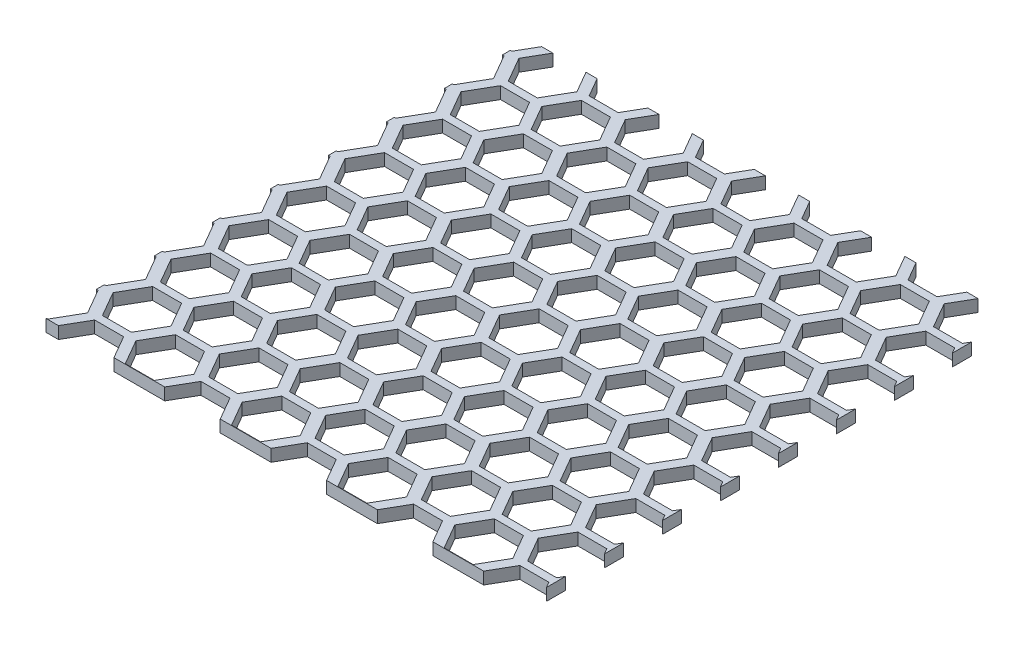
from build123d import *

# Parameters (mm, degrees)
BOSS_EXTRUDE1_DEPTH = 25


with BuildPart() as part:
    # Sketch3 → Boss-Extrude1 (new body)
    with BuildSketch(Plane(origin=(0, 0, 0), x_dir=(1, 0, 0), z_dir=(0, 1, 0))):
        Polygon((147.588442541, 499.910197686), (124.494431774, 499.910197686), (101.933591751, 460.833676505), (98.761267505, 460.833676505), (98.761267505, 444.756724959), (101.933591751, 444.756724959), (131.933591751, 392.795200732), (101.933591751, 340.833676505), (98.761267505, 340.833676505), (98.761267505, 324.756724959), (101.933591751, 324.756724959), (131.933591751, 272.795200732), (101.933591751, 220.833676505), (98.761267505, 220.833676505), (98.761267505, 204.756724959), (101.933591751, 204.756724959), (131.933591751, 152.795200732), (101.933591751, 100.833676505), (98.761267505, 100.833676505), (98.761267505, 84.756724959), (101.933591751, 84.756724959), (131.933591751, 32.795200732), (101.933591751, -19.166323495), (98.761267505, -19.166323495), (98.761267505, -35.243275041), (101.933591751, -35.243275041), (131.933591751, -87.204799268), (101.933591751, -139.166323495), (98.761267505, -139.166323495), (98.761267505, -155.243275041), (101.933591751, -155.243275041), (131.933591751, -207.204799268), (101.933591751, -259.166323495), (98.761267505, -259.166323495), (98.761267505, -275.243275041), (101.933591751, -275.243275041), (131.933591751, -327.204799268), (101.933591751, -379.166323495), (98.761267505, -379.166323495), (98.761267505, -395.243275041), (101.933591751, -395.243275041), (131.933591751, -447.204799268), (101.933591751, -499.166323495), (98.761267505, -499.166323495), (98.761267505, -500.089802314), (124.494431774, -500.089802314), (151.933591751, -452.563783117), (211.933591751, -452.563783117), (239.372751728, -500.089802314), (344.494431774, -500.089802314), (371.933591751, -452.563783117), (431.933591751, -452.563783117), (459.372751728, -500.089802314), (564.494431774, -500.089802314), (591.933591751, -452.563783117), (651.933591751, -452.563783117), (679.372751728, -500.089802314), (784.494431774, -500.089802314), (811.933591751, -452.563783117), (871.933591751, -452.563783117), (899.372751728, -500.089802314), (1004.494431774, -500.089802314), (1031.933591751, -452.563783117), (1091.933591751, -452.563783117), (1098.761267505, -464.389664421), (1098.761267505, -424.660950267), (1091.933591751, -436.486831571), (1031.933591751, -436.486831571), (1001.933591751, -384.525307344), (1031.933591751, -332.563783117), (1091.933591751, -332.563783117), (1098.761267505, -344.389664421), (1098.761267505, -304.660950267), (1091.933591751, -316.486831571), (1031.933591751, -316.486831571), (1001.933591751, -264.525307344), (1031.933591751, -212.563783117), (1091.933591751, -212.563783117), (1098.761267505, -224.389664421), (1098.761267505, -184.660950267), (1091.933591751, -196.486831571), (1031.933591751, -196.486831571), (1001.933591751, -144.525307344), (1031.933591751, -92.563783117), (1091.933591751, -92.563783117), (1098.761267505, -104.389664421), (1098.761267505, -64.660950267), (1091.933591751, -76.486831571), (1031.933591751, -76.486831571), (1001.933591751, -24.525307344), (1031.933591751, 27.436216883), (1091.933591751, 27.436216883), (1098.761267505, 15.610335579), (1098.761267505, 55.339049733), (1091.933591751, 43.513168429), (1031.933591751, 43.513168429), (1001.933591751, 95.474692656), (1031.933591751, 147.436216883), (1091.933591751, 147.436216883), (1098.761267505, 135.610335579), (1098.761267505, 175.339049733), (1091.933591751, 163.513168429), (1031.933591751, 163.513168429), (1001.933591751, 215.474692656), (1031.933591751, 267.436216883), (1091.933591751, 267.436216883), (1098.761267505, 255.610335579), (1098.761267505, 295.339049733), (1091.933591751, 283.513168429), (1031.933591751, 283.513168429), (1001.933591751, 335.474692656), (1031.933591751, 387.436216883), (1091.933591751, 387.436216883), (1098.761267505, 375.610335579), (1098.761267505, 415.339049733), (1091.933591751, 403.513168429), (1031.933591751, 403.513168429), (1001.933591751, 455.474692656), (1027.588442541, 499.910197686), (1004.494431774, 499.910197686), (981.933591751, 460.833676505), (921.933591751, 460.833676505), (899.372751728, 499.910197686), (876.27874096, 499.910197686), (901.933591751, 455.474692656), (871.933591751, 403.513168429), (811.933591751, 403.513168429), (781.933591751, 455.474692656), (807.588442541, 499.910197686), (784.494431774, 499.910197686), (761.933591751, 460.833676505), (701.933591751, 460.833676505), (679.372751728, 499.910197686), (656.27874096, 499.910197686), (681.933591751, 455.474692656), (651.933591751, 403.513168429), (591.933591751, 403.513168429), (561.933591751, 455.474692656), (587.588442541, 499.910197686), (564.494431774, 499.910197686), (541.933591751, 460.833676505), (481.933591751, 460.833676505), (459.372751728, 499.910197686), (436.27874096, 499.910197686), (461.933591751, 455.474692656), (431.933591751, 403.513168429), (371.933591751, 403.513168429), (341.933591751, 455.474692656), (367.588442541, 499.910197686), (344.494431774, 499.910197686), (321.933591751, 460.833676505), (261.933591751, 460.833676505), (239.372751728, 499.910197686), (216.27874096, 499.910197686), (241.933591751, 455.474692656), (211.933591751, 403.513168429), (151.933591751, 403.513168429), (121.933591751, 455.474692656), align=None)
        Polygon((321.933591751, -395.243275041), (351.933591751, -447.204799268), (321.933591751, -499.166323495), (261.933591751, -499.166323495), (231.933591751, -447.204799268), (261.933591751, -395.243275041), align=None, mode=Mode.SUBTRACT)
        Polygon((211.933591751, -332.563783117), (241.933591751, -384.525307344), (211.933591751, -436.486831571), (151.933591751, -436.486831571), (121.933591751, -384.525307344), (151.933591751, -332.563783117), align=None, mode=Mode.SUBTRACT)
        Polygon((431.933591751, -332.563783117), (461.933591751, -384.525307344), (431.933591751, -436.486831571), (371.933591751, -436.486831571), (341.933591751, -384.525307344), (371.933591751, -332.563783117), align=None, mode=Mode.SUBTRACT)
        Polygon((541.933591751, -395.243275041), (571.933591751, -447.204799268), (541.933591751, -499.166323495), (481.933591751, -499.166323495), (451.933591751, -447.204799268), (481.933591751, -395.243275041), align=None, mode=Mode.SUBTRACT)
        Polygon((651.933591751, -332.563783117), (681.933591751, -384.525307344), (651.933591751, -436.486831571), (591.933591751, -436.486831571), (561.933591751, -384.525307344), (591.933591751, -332.563783117), align=None, mode=Mode.SUBTRACT)
        Polygon((321.933591751, -275.243275041), (351.933591751, -327.204799268), (321.933591751, -379.166323495), (261.933591751, -379.166323495), (231.933591751, -327.204799268), (261.933591751, -275.243275041), align=None, mode=Mode.SUBTRACT)
        Polygon((211.933591751, -212.563783117), (241.933591751, -264.525307344), (211.933591751, -316.486831571), (151.933591751, -316.486831571), (121.933591751, -264.525307344), (151.933591751, -212.563783117), align=None, mode=Mode.SUBTRACT)
        Polygon((211.933591751, -92.563783117), (241.933591751, -144.525307344), (211.933591751, -196.486831571), (151.933591751, -196.486831571), (121.933591751, -144.525307344), (151.933591751, -92.563783117), align=None, mode=Mode.SUBTRACT)
        Polygon((321.933591751, -155.243275041), (351.933591751, -207.204799268), (321.933591751, -259.166323495), (261.933591751, -259.166323495), (231.933591751, -207.204799268), (261.933591751, -155.243275041), align=None, mode=Mode.SUBTRACT)
        Polygon((321.933591751, -35.243275041), (351.933591751, -87.204799268), (321.933591751, -139.166323495), (261.933591751, -139.166323495), (231.933591751, -87.204799268), (261.933591751, -35.243275041), align=None, mode=Mode.SUBTRACT)
        Polygon((431.933591751, -212.563783117), (461.933591751, -264.525307344), (431.933591751, -316.486831571), (371.933591751, -316.486831571), (341.933591751, -264.525307344), (371.933591751, -212.563783117), align=None, mode=Mode.SUBTRACT)
        Polygon((541.933591751, -275.243275041), (571.933591751, -327.204799268), (541.933591751, -379.166323495), (481.933591751, -379.166323495), (451.933591751, -327.204799268), (481.933591751, -275.243275041), align=None, mode=Mode.SUBTRACT)
        Polygon((651.933591751, -212.563783117), (681.933591751, -264.525307344), (651.933591751, -316.486831571), (591.933591751, -316.486831571), (561.933591751, -264.525307344), (591.933591751, -212.563783117), align=None, mode=Mode.SUBTRACT)
        Polygon((431.933591751, -92.563783117), (461.933591751, -144.525307344), (431.933591751, -196.486831571), (371.933591751, -196.486831571), (341.933591751, -144.525307344), (371.933591751, -92.563783117), align=None, mode=Mode.SUBTRACT)
        Polygon((541.933591751, -155.243275041), (571.933591751, -207.204799268), (541.933591751, -259.166323495), (481.933591751, -259.166323495), (451.933591751, -207.204799268), (481.933591751, -155.243275041), align=None, mode=Mode.SUBTRACT)
        Polygon((651.933591751, -92.563783117), (681.933591751, -144.525307344), (651.933591751, -196.486831571), (591.933591751, -196.486831571), (561.933591751, -144.525307344), (591.933591751, -92.563783117), align=None, mode=Mode.SUBTRACT)
        Polygon((541.933591751, -35.243275041), (571.933591751, -87.204799268), (541.933591751, -139.166323495), (481.933591751, -139.166323495), (451.933591751, -87.204799268), (481.933591751, -35.243275041), align=None, mode=Mode.SUBTRACT)
        Polygon((761.933591751, -395.243275041), (791.933591751, -447.204799268), (761.933591751, -499.166323495), (701.933591751, -499.166323495), (671.933591751, -447.204799268), (701.933591751, -395.243275041), align=None, mode=Mode.SUBTRACT)
        Polygon((871.933591751, -332.563783117), (901.933591751, -384.525307344), (871.933591751, -436.486831571), (811.933591751, -436.486831571), (781.933591751, -384.525307344), (811.933591751, -332.563783117), align=None, mode=Mode.SUBTRACT)
        Polygon((981.933591751, -395.243275041), (1011.933591751, -447.204799268), (981.933591751, -499.166323495), (921.933591751, -499.166323495), (891.933591751, -447.204799268), (921.933591751, -395.243275041), align=None, mode=Mode.SUBTRACT)
        Polygon((761.933591751, -275.243275041), (791.933591751, -327.204799268), (761.933591751, -379.166323495), (701.933591751, -379.166323495), (671.933591751, -327.204799268), (701.933591751, -275.243275041), align=None, mode=Mode.SUBTRACT)
        Polygon((871.933591751, -212.563783117), (901.933591751, -264.525307344), (871.933591751, -316.486831571), (811.933591751, -316.486831571), (781.933591751, -264.525307344), (811.933591751, -212.563783117), align=None, mode=Mode.SUBTRACT)
        Polygon((981.933591751, -275.243275041), (1011.933591751, -327.204799268), (981.933591751, -379.166323495), (921.933591751, -379.166323495), (891.933591751, -327.204799268), (921.933591751, -275.243275041), align=None, mode=Mode.SUBTRACT)
        Polygon((761.933591751, -155.243275041), (791.933591751, -207.204799268), (761.933591751, -259.166323495), (701.933591751, -259.166323495), (671.933591751, -207.204799268), (701.933591751, -155.243275041), align=None, mode=Mode.SUBTRACT)
        Polygon((871.933591751, -92.563783117), (901.933591751, -144.525307344), (871.933591751, -196.486831571), (811.933591751, -196.486831571), (781.933591751, -144.525307344), (811.933591751, -92.563783117), align=None, mode=Mode.SUBTRACT)
        Polygon((761.933591751, -35.243275041), (791.933591751, -87.204799268), (761.933591751, -139.166323495), (701.933591751, -139.166323495), (671.933591751, -87.204799268), (701.933591751, -35.243275041), align=None, mode=Mode.SUBTRACT)
        Polygon((981.933591751, -155.243275041), (1011.933591751, -207.204799268), (981.933591751, -259.166323495), (921.933591751, -259.166323495), (891.933591751, -207.204799268), (921.933591751, -155.243275041), align=None, mode=Mode.SUBTRACT)
        Polygon((981.933591751, -35.243275041), (1011.933591751, -87.204799268), (981.933591751, -139.166323495), (921.933591751, -139.166323495), (891.933591751, -87.204799268), (921.933591751, -35.243275041), align=None, mode=Mode.SUBTRACT)
        Polygon((211.933591751, 27.436216883), (241.933591751, -24.525307344), (211.933591751, -76.486831571), (151.933591751, -76.486831571), (121.933591751, -24.525307344), (151.933591751, 27.436216883), align=None, mode=Mode.SUBTRACT)
        Polygon((211.933591751, 147.436216883), (241.933591751, 95.474692656), (211.933591751, 43.513168429), (151.933591751, 43.513168429), (121.933591751, 95.474692656), (151.933591751, 147.436216883), align=None, mode=Mode.SUBTRACT)
        Polygon((321.933591751, 84.756724959), (351.933591751, 32.795200732), (321.933591751, -19.166323495), (261.933591751, -19.166323495), (231.933591751, 32.795200732), (261.933591751, 84.756724959), align=None, mode=Mode.SUBTRACT)
        Polygon((321.933591751, 204.756724959), (351.933591751, 152.795200732), (321.933591751, 100.833676505), (261.933591751, 100.833676505), (231.933591751, 152.795200732), (261.933591751, 204.756724959), align=None, mode=Mode.SUBTRACT)
        Polygon((211.933591751, 267.436216883), (241.933591751, 215.474692656), (211.933591751, 163.513168429), (151.933591751, 163.513168429), (121.933591751, 215.474692656), (151.933591751, 267.436216883), align=None, mode=Mode.SUBTRACT)
        Polygon((431.933591751, 27.436216883), (461.933591751, -24.525307344), (431.933591751, -76.486831571), (371.933591751, -76.486831571), (341.933591751, -24.525307344), (371.933591751, 27.436216883), align=None, mode=Mode.SUBTRACT)
        Polygon((431.933591751, 147.436216883), (461.933591751, 95.474692656), (431.933591751, 43.513168429), (371.933591751, 43.513168429), (341.933591751, 95.474692656), (371.933591751, 147.436216883), align=None, mode=Mode.SUBTRACT)
        Polygon((651.933591751, 27.436216883), (681.933591751, -24.525307344), (651.933591751, -76.486831571), (591.933591751, -76.486831571), (561.933591751, -24.525307344), (591.933591751, 27.436216883), align=None, mode=Mode.SUBTRACT)
        Polygon((541.933591751, 84.756724959), (571.933591751, 32.795200732), (541.933591751, -19.166323495), (481.933591751, -19.166323495), (451.933591751, 32.795200732), (481.933591751, 84.756724959), align=None, mode=Mode.SUBTRACT)
        Polygon((651.933591751, 147.436216883), (681.933591751, 95.474692656), (651.933591751, 43.513168429), (591.933591751, 43.513168429), (561.933591751, 95.474692656), (591.933591751, 147.436216883), align=None, mode=Mode.SUBTRACT)
        Polygon((431.933591751, 267.436216883), (461.933591751, 215.474692656), (431.933591751, 163.513168429), (371.933591751, 163.513168429), (341.933591751, 215.474692656), (371.933591751, 267.436216883), align=None, mode=Mode.SUBTRACT)
        Polygon((541.933591751, 204.756724959), (571.933591751, 152.795200732), (541.933591751, 100.833676505), (481.933591751, 100.833676505), (451.933591751, 152.795200732), (481.933591751, 204.756724959), align=None, mode=Mode.SUBTRACT)
        Polygon((651.933591751, 267.436216883), (681.933591751, 215.474692656), (651.933591751, 163.513168429), (591.933591751, 163.513168429), (561.933591751, 215.474692656), (591.933591751, 267.436216883), align=None, mode=Mode.SUBTRACT)
        Polygon((321.933591751, 324.756724959), (351.933591751, 272.795200732), (321.933591751, 220.833676505), (261.933591751, 220.833676505), (231.933591751, 272.795200732), (261.933591751, 324.756724959), align=None, mode=Mode.SUBTRACT)
        Polygon((211.933591751, 387.436216883), (241.933591751, 335.474692656), (211.933591751, 283.513168429), (151.933591751, 283.513168429), (121.933591751, 335.474692656), (151.933591751, 387.436216883), align=None, mode=Mode.SUBTRACT)
        Polygon((321.933591751, 444.756724959), (351.933591751, 392.795200732), (321.933591751, 340.833676505), (261.933591751, 340.833676505), (231.933591751, 392.795200732), (261.933591751, 444.756724959), align=None, mode=Mode.SUBTRACT)
        Polygon((431.933591751, 387.436216883), (461.933591751, 335.474692656), (431.933591751, 283.513168429), (371.933591751, 283.513168429), (341.933591751, 335.474692656), (371.933591751, 387.436216883), align=None, mode=Mode.SUBTRACT)
        Polygon((541.933591751, 324.756724959), (571.933591751, 272.795200732), (541.933591751, 220.833676505), (481.933591751, 220.833676505), (451.933591751, 272.795200732), (481.933591751, 324.756724959), align=None, mode=Mode.SUBTRACT)
        Polygon((541.933591751, 444.756724959), (571.933591751, 392.795200732), (541.933591751, 340.833676505), (481.933591751, 340.833676505), (451.933591751, 392.795200732), (481.933591751, 444.756724959), align=None, mode=Mode.SUBTRACT)
        Polygon((651.933591751, 387.436216883), (681.933591751, 335.474692656), (651.933591751, 283.513168429), (591.933591751, 283.513168429), (561.933591751, 335.474692656), (591.933591751, 387.436216883), align=None, mode=Mode.SUBTRACT)
        Polygon((871.933591751, 27.436216883), (901.933591751, -24.525307344), (871.933591751, -76.486831571), (811.933591751, -76.486831571), (781.933591751, -24.525307344), (811.933591751, 27.436216883), align=None, mode=Mode.SUBTRACT)
        Polygon((761.933591751, 84.756724959), (791.933591751, 32.795200732), (761.933591751, -19.166323495), (701.933591751, -19.166323495), (671.933591751, 32.795200732), (701.933591751, 84.756724959), align=None, mode=Mode.SUBTRACT)
        Polygon((871.933591751, 147.436216883), (901.933591751, 95.474692656), (871.933591751, 43.513168429), (811.933591751, 43.513168429), (781.933591751, 95.474692656), (811.933591751, 147.436216883), align=None, mode=Mode.SUBTRACT)
        Polygon((981.933591751, 84.756724959), (1011.933591751, 32.795200732), (981.933591751, -19.166323495), (921.933591751, -19.166323495), (891.933591751, 32.795200732), (921.933591751, 84.756724959), align=None, mode=Mode.SUBTRACT)
        Polygon((761.933591751, 204.756724959), (791.933591751, 152.795200732), (761.933591751, 100.833676505), (701.933591751, 100.833676505), (671.933591751, 152.795200732), (701.933591751, 204.756724959), align=None, mode=Mode.SUBTRACT)
        Polygon((871.933591751, 267.436216883), (901.933591751, 215.474692656), (871.933591751, 163.513168429), (811.933591751, 163.513168429), (781.933591751, 215.474692656), (811.933591751, 267.436216883), align=None, mode=Mode.SUBTRACT)
        Polygon((981.933591751, 204.756724959), (1011.933591751, 152.795200732), (981.933591751, 100.833676505), (921.933591751, 100.833676505), (891.933591751, 152.795200732), (921.933591751, 204.756724959), align=None, mode=Mode.SUBTRACT)
        Polygon((761.933591751, 324.756724959), (791.933591751, 272.795200732), (761.933591751, 220.833676505), (701.933591751, 220.833676505), (671.933591751, 272.795200732), (701.933591751, 324.756724959), align=None, mode=Mode.SUBTRACT)
        Polygon((761.933591751, 444.756724959), (791.933591751, 392.795200732), (761.933591751, 340.833676505), (701.933591751, 340.833676505), (671.933591751, 392.795200732), (701.933591751, 444.756724959), align=None, mode=Mode.SUBTRACT)
        Polygon((871.933591751, 387.436216883), (901.933591751, 335.474692656), (871.933591751, 283.513168429), (811.933591751, 283.513168429), (781.933591751, 335.474692656), (811.933591751, 387.436216883), align=None, mode=Mode.SUBTRACT)
        Polygon((981.933591751, 324.756724959), (1011.933591751, 272.795200732), (981.933591751, 220.833676505), (921.933591751, 220.833676505), (891.933591751, 272.795200732), (921.933591751, 324.756724959), align=None, mode=Mode.SUBTRACT)
        Polygon((981.933591751, 444.756724959), (1011.933591751, 392.795200732), (981.933591751, 340.833676505), (921.933591751, 340.833676505), (891.933591751, 392.795200732), (921.933591751, 444.756724959), align=None, mode=Mode.SUBTRACT)
    extrude(amount=BOSS_EXTRUDE1_DEPTH)


solid = part.part
